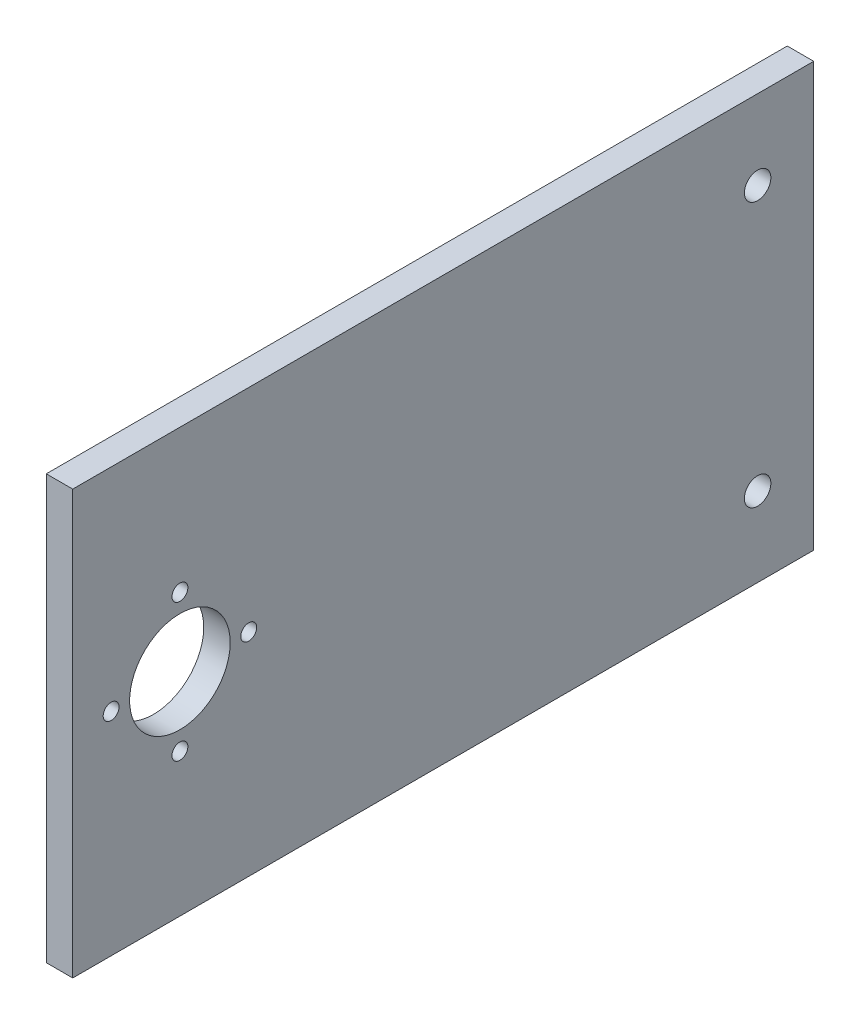
from build123d import *

# Parameters (mm, degrees)
SKETCH1_W           = 80
SKETCH1_H           = 140
SKETCH1_R           = 1.5
SKETCH1_R_2         = 9.5
SKETCH1_R_3         = 2.5
BOSS_EXTRUDE1_DEPTH = 5


with BuildPart() as part:
    # Sketch1 → Boss-Extrude1 (new body)
    with BuildSketch(Plane.YZ):
        Rectangle(SKETCH1_W, SKETCH1_H)
        with Locations((0, 62.75)):
            Circle(SKETCH1_R, mode=Mode.SUBTRACT)
        with Locations((0, 36.75)):
            Circle(SKETCH1_R, mode=Mode.SUBTRACT)
        with Locations((-13, 49.75)):
            Circle(SKETCH1_R, mode=Mode.SUBTRACT)
        with Locations((13, 49.75)):
            Circle(SKETCH1_R, mode=Mode.SUBTRACT)
        with Locations((0, 49.75)):
            Circle(SKETCH1_R_2, mode=Mode.SUBTRACT)
        with Locations((-25, -59.4)):
            Circle(SKETCH1_R_3, mode=Mode.SUBTRACT)
        with Locations((25, -59.4)):
            Circle(SKETCH1_R_3, mode=Mode.SUBTRACT)
    extrude(amount=BOSS_EXTRUDE1_DEPTH)


solid = part.part
